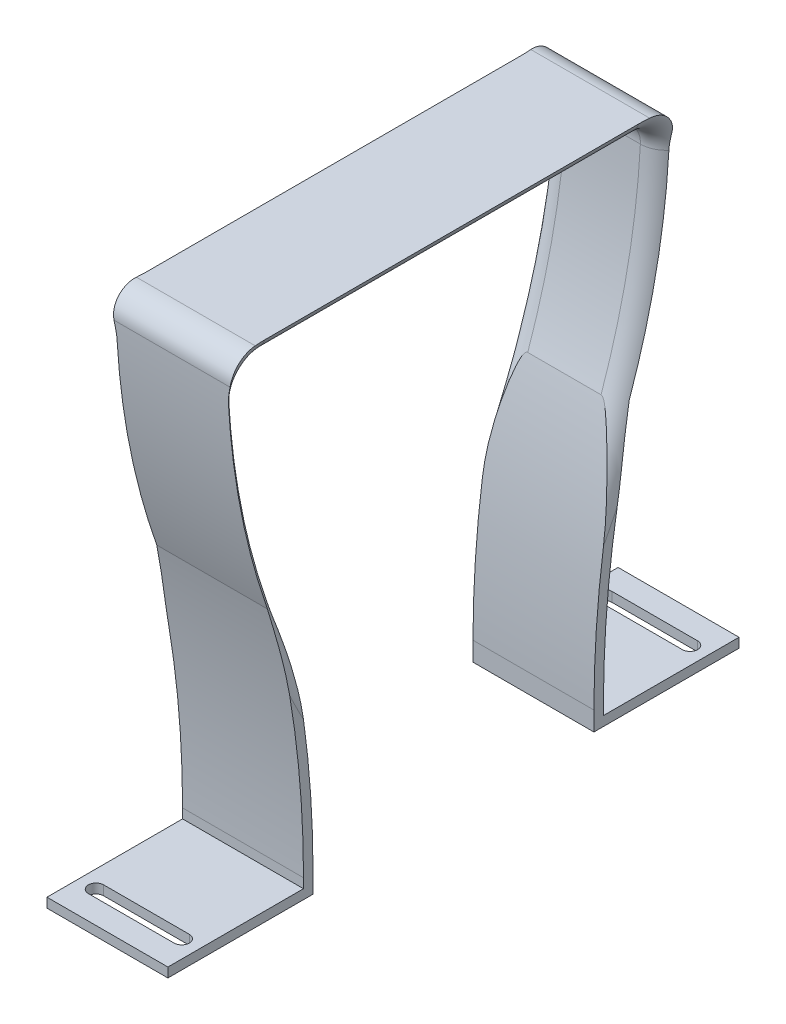
from build123d import *

# Parameters (mm, degrees)
BOSS_EXTRUDE2_DEPTH = 25.4
CUT_EXTRUDE1_DEPTH  = 10
FILLET2_R           = 5
FILLET3_R           = 5


with BuildPart() as part:
    # Sketch2 → Boss-Extrude2 (new body)
    with BuildSketch(Plane(origin=(0, 0, 0), x_dir=(0, 0, -1), z_dir=(1, 0, 0))):
        with BuildLine():
            Line((-42.16325716381999, 102.24495340802004), (-42.16325716381999, 105.50685076697965))
            Line((-42.16325716381999, 105.50685076697965), (-71.66325716381999, 105.50685076697965))
            Line((-71.66325716381999, 105.50685076697965), (-73.66325716381999, 105.50685076697965))
            Line((-73.66325716381999, 105.50685076697965), (-83.66325716381999, 105.50685076697965))
            Line((-83.66325716381999, 105.50685076697965), (-88.66325716381999, 105.50685076697965))
            ThreePointArc((-88.66325716381998, 105.50685076697965), (-86.52312196361042, 80.14817375101529), (-80.16325716382, 55.50685076697966))
            ThreePointArc((-80.16325716382005, 55.50685076697965), (-75.29465296973282, 29.910744706157303), (-73.66325716382002, 3.9068507669796584))
            Line((-73.66325716381999, 3.9068507669796584), (-73.66325716381999, 1.906850766979658))
            Line((-73.66325716381999, 1.906850766979658), (-102.14325716382002, 1.9068507669796584))
            Line((-102.14325716382002, 1.9068507669796584), (-102.14325716382004, -0.09314923302034162))
            Line((-102.14325716382004, -0.09314923302034157), (-77.14325716382007, -0.09314923302034157))
            Line((-77.14325716382007, -0.09314923302034157), (-75.14325716382005, -0.09314923302034157))
            Line((-75.14325716382005, -0.09314923302034157), (-71.66325716381999, -0.09314923302034157))
            Line((-71.66325716381999, -0.09314923302034157), (-71.66325716381999, 3.9068507669796584))
            ThreePointArc((-71.66325716382002, 3.9068507669796584), (-73.29465296973277, 29.910744706156674), (-78.16325716381962, 55.50685076697843))
            ThreePointArc((-78.16325716381958, 55.50685076697843), (-84.24109955064954, 78.54167340431034), (-86.62809328298779, 102.24495340802004))
            Line((-86.62809328298776, 102.24495340802004), (-83.66325716381999, 102.24495340802004))
            Line((-83.66325716381999, 102.24495340802004), (-73.66325716381999, 102.24495340802004))
            Line((-73.66325716381999, 102.24495340802004), (-71.66325716381999, 102.24495340802004))
            Line((-71.66325716381999, 102.24495340802004), (-42.16325716381999, 102.24495340802004))
        make_face()
        Polygon((-12.663257163819978, 105.50685076697965), (-42.16325716381999, 105.50685076697965), (-42.16325716381999, 102.24495340802004), (-12.663257163819992, 102.24495340802004), (-10.663257163819992, 102.24495340802004), (-10.663257163819996, 105.50685076697965), align=None)
        with BuildLine():
            Line((4.3367428361800044, 105.50685076697967), (-10.663257163819996, 105.50685076697965))
            Line((-10.663257163819996, 105.50685076697965), (-10.663257163819996, 102.24495340802004))
            Line((-10.663257163819996, 102.24495340802004), (2.301578955347793, 102.24495340802004))
            Line((2.301578955347793, 102.24495340802004), (4.301578955347801, 102.24495340802004))
            ThreePointArc((4.301578955347793, 102.24495340802004), (4.32795161058155, 103.87580732190355), (4.336742836180008, 105.50685076697967))
        make_face()
        with BuildLine():
            Line((4.301578955347801, 102.24495340802004), (2.301578955347793, 102.24495340802004))
            ThreePointArc((2.301578955347793, 102.24495340802004), (-0.08541477699043298, 78.54167340431036), (-6.163257163820418, 55.50685076697844))
            ThreePointArc((-6.16325716382039, 55.506850766978445), (-11.031861357907275, 29.91074470615667), (-12.663257163819992, 3.9068507669796566))
            Line((-12.663257163819996, 3.9068507669796566), (-10.663257163820356, 3.9068507669796917))
            ThreePointArc((-10.663257163820361, 3.9068507669796917), (-9.03186135790753, 29.91074470615736), (-4.163257163819992, 55.50685076697967))
            ThreePointArc((-4.163257163819964, 55.50685076697966), (1.9145852230096523, 78.54167340431098), (4.301578955347793, 102.24495340802004))
        make_face()
        Polygon((-10.663257163820356, 3.9068507669796917), (-12.663257163819996, 3.9068507669796566), (-12.663257163819981, 1.906850766979662), (-12.663257163819981, -0.0931492330203384), (-10.663257163819981, -0.09314923302033815), (17.816742836180058, -0.0931492330203384), (17.81674283618006, 1.906850766979662), (-10.663257163820356, 1.906850766979662), align=None)
    extrude(amount=BOSS_EXTRUDE2_DEPTH)

    # Sketch4 → Cut-Extrude1 (cut)
    with BuildSketch(Plane(origin=(0, 1.906850766979657, -3e-17), x_dir=(1, 0, 0), z_dir=(0, 1, -2e-17))):
        with BuildLine():
            Line((12.7, 12.816742836180062), (3.7, 12.816742836180062))
            ThreePointArc((3.6999999999999997, 12.816742836180062), (2.100000000000011, 11.216742836180066), (3.7, 9.61674283618007))
            Line((3.6999999999999993, 9.616742836180068), (12.7, 9.616742836180068))
            Line((12.7, 9.616742836180068), (12.7, 12.816742836180062))
        make_face()
        with BuildLine():
            Line((21.699999999999996, 12.816742836180062), (12.7, 12.816742836180062))
            Line((12.7, 12.816742836180062), (12.7, 9.616742836180068))
            Line((12.7, 9.616742836180068), (21.699999999999996, 9.616742836180068))
            ThreePointArc((21.699999999999996, 9.616742836180068), (23.299999999999983, 11.216742836180066), (21.699999999999996, 12.816742836180063))
        make_face()
        with BuildLine():
            Line((3.7, -97.14325716382002), (12.7, -97.14325716382002))
            Line((12.7, -97.14325716382002), (12.7, -93.94325716382004))
            Line((12.7, -93.94325716382004), (3.6999999999999993, -93.94325716382004))
            ThreePointArc((3.7, -93.94325716382005), (2.10000000000002, -95.54325716382004), (3.7, -97.14325716382004))
        make_face()
        with BuildLine():
            Line((12.7, -93.94325716382004), (12.7, -97.14325716382002))
            Line((12.7, -97.14325716382002), (21.699999999999996, -97.14325716382002))
            ThreePointArc((21.699999999999996, -97.14325716382004), (23.299999999999976, -95.54325716382004), (21.699999999999996, -93.94325716382005))
            Line((21.699999999999996, -93.94325716382004), (12.7, -93.94325716382004))
        make_face()
    extrude(amount=-CUT_EXTRUDE1_DEPTH, mode=Mode.SUBTRACT)

    # Fillet2
    fillet2_edges = [part.edges().sort_by_distance(p)[0] for p in [
        (12.7, 105.50685076697965, 88.66325716381998),
        (12.7, 105.50685076697967, -4.336742836180006),
        (12.7, 102.24495340802004, -2.301578955347807),
        (12.7, 102.24495340802004, 86.62809328298778),
    ]]
    fillet(fillet2_edges, radius=FILLET2_R)

    # Fillet3
    # the kernel refuses this fillet: 5 mm, written as the material it takes off along each edge
    with BuildSketch(Plane(origin=(25.4, 105.50685076698011, 148.97208069323426), x_dir=(0, -0.05646889339725343, -0.998404359004151), z_dir=(0, 0.998404359004151, -0.05646889339725343))) as fillet3_piece_1:
        with BuildLine():
            CenterArc((151.3088235294143 + FILLET3_R, FILLET3_R), FILLET3_R, 180, 90)
            Line((151.3088235294143, FILLET3_R), (151.3088235294143, 0))
            Line((151.3088235294143, 0), (151.3088235294143 + FILLET3_R, 0))
        make_face()
    revolve(axis=Axis((25.4, 105.50685076698011, 148.97208069323426), (-1, 0, 0)), revolution_arc=30.25916351714883, mode=Mode.SUBTRACT)
    with BuildSketch(Plane(origin=(0, 105.50685076698011, 148.97208069323426), x_dir=(0, -0.05646889339725343, -0.998404359004151), z_dir=(0, 0.998404359004151, -0.05646889339725343))) as fillet3_piece_2:
        with BuildLine():
            CenterArc((151.3088235294143 + FILLET3_R, -FILLET3_R), FILLET3_R, 90, 90)
            Line((151.3088235294143 + FILLET3_R, 8.9e-16), (151.3088235294143, 0))
            Line((151.3088235294143, 0), (151.3088235294143, -FILLET3_R))
        make_face()
    revolve(axis=Axis((0, 105.50685076698011, 148.97208069323426), (-1, 0, 0)), revolution_arc=30.25916351714883, mode=Mode.SUBTRACT)
    with BuildSketch(Plane(origin=(25.4, 97.24495340802004, 2.8967135206979435), x_dir=(0, 1, 9e-17), z_dir=(0, -9e-17, 1))) as fillet3_piece_3:
        with BuildLine():
            CenterArc((5 + FILLET3_R, FILLET3_R), FILLET3_R, 180, 90)
            Line((5, FILLET3_R), (5, 0))
            Line((5, 0), (5 + FILLET3_R, 0))
        make_face()
    revolve(axis=Axis((25.4, 97.24495340802004, 2.8967135206979435), (-1, 0, 0)), revolution_arc=93.23715122573067, mode=Mode.SUBTRACT)
    with BuildSketch(Plane(origin=(0, 97.24495340802004, 2.8967135206979435), x_dir=(0, 1, 9e-17), z_dir=(0, -9e-17, 1))) as fillet3_piece_4:
        with BuildLine():
            CenterArc((5 + FILLET3_R, -FILLET3_R), FILLET3_R, 90, 90)
            Line((5 + FILLET3_R, 8.9e-16), (5, 0))
            Line((5, 0), (5, -FILLET3_R))
        make_face()
    revolve(axis=Axis((0, 97.24495340802004, 2.8967135206979435), (-1, 0, 0)), revolution_arc=93.23715122573067, mode=Mode.SUBTRACT)
    with BuildSketch(Plane(origin=(0, 105.50685076698024, -64.64556636559493), x_dir=(0, -0.5518833487422847, 0.8339213208576705), z_dir=(0, -0.8339213208576705, -0.5518833487422847))) as fillet3_piece_5:
        with BuildLine():
            CenterArc((151.30882352941498 + FILLET3_R, -FILLET3_R), FILLET3_R, 90, 90)
            Line((151.30882352941498 + FILLET3_R, 8.9e-16), (151.30882352941498, 0))
            Line((151.30882352941498, 0), (151.30882352941498, -FILLET3_R))
        make_face()
    revolve(axis=Axis((0, 105.50685076698024, -64.64556636559493), (-1, 0, 0)), revolution_arc=30.2591635171487, mode=Mode.SUBTRACT)
    with BuildSketch(Plane(origin=(25.4, 105.50685076698024, -64.64556636559493), x_dir=(0, -0.5518833487422847, 0.8339213208576705), z_dir=(0, -0.8339213208576705, -0.5518833487422847))) as fillet3_piece_6:
        with BuildLine():
            CenterArc((151.30882352941498 + FILLET3_R, FILLET3_R), FILLET3_R, 180, 90)
            Line((151.30882352941498, FILLET3_R), (151.30882352941498, 0))
            Line((151.30882352941498, 0), (151.30882352941498 + FILLET3_R, 0))
        make_face()
    revolve(axis=Axis((25.4, 105.50685076698024, -64.64556636559493), (-1, 0, 0)), revolution_arc=30.2591635171487, mode=Mode.SUBTRACT)
    with BuildSketch(Plane(origin=(25.4, 97.24495340802004, 81.42980080694204), x_dir=(0, -0.05646889339725767, 0.9984043590041507), z_dir=(0, -0.9984043590041507, -0.05646889339725767))) as fillet3_piece_7:
        with BuildLine():
            CenterArc((4.999999999999993 + FILLET3_R, FILLET3_R), FILLET3_R, 180, 90)
            Line((4.999999999999993, FILLET3_R), (4.999999999999993, 0))
            Line((4.999999999999993, 0), (4.999999999999993 + FILLET3_R, 0))
        make_face()
    revolve(axis=Axis((25.4, 97.24495340802004, 81.42980080694204), (-1, 0, 0)), revolution_arc=93.237151225731, mode=Mode.SUBTRACT)
    with BuildSketch(Plane(origin=(0, 97.24495340802004, 81.42980080694204), x_dir=(0, -0.05646889339725767, 0.9984043590041507), z_dir=(0, -0.9984043590041507, -0.05646889339725767))) as fillet3_piece_8:
        with BuildLine():
            CenterArc((4.999999999999993 + FILLET3_R, -FILLET3_R), FILLET3_R, 90, 90)
            Line((4.999999999999993 + FILLET3_R, 8.9e-16), (4.999999999999993, 0))
            Line((4.999999999999993, 0), (4.999999999999993, -FILLET3_R))
        make_face()
    revolve(axis=Axis((0, 97.24495340802004, 81.42980080694204), (-1, 0, 0)), revolution_arc=93.237151225731, mode=Mode.SUBTRACT)
    with BuildSketch(Plane(origin=(0, 102.24495340802004, 81.42980080694204), x_dir=(1, 0, 0), z_dir=(0, 0, -1))) as fillet3_piece_9:
        with BuildLine():
            CenterArc((FILLET3_R, -FILLET3_R), FILLET3_R, 90, 90)
            Line((-8.9e-16, -FILLET3_R), (0, 0))
            Line((0, 0), (FILLET3_R, 0))
        make_face()
    extrude(amount=78.5330872862441, mode=Mode.SUBTRACT)
    with BuildSketch(Plane(origin=(25.4, 102.24495340802004, 81.42980080694204), x_dir=(0, 1, 0), z_dir=(0, 0, -1))) as fillet3_piece_10:
        with BuildLine():
            CenterArc((FILLET3_R, -FILLET3_R), FILLET3_R, 90, 90)
            Line((0, -FILLET3_R), (0, 0))
            Line((0, 0), (FILLET3_R, 0))
        make_face()
    extrude(amount=78.5330872862441, mode=Mode.SUBTRACT)


solid = part.part
